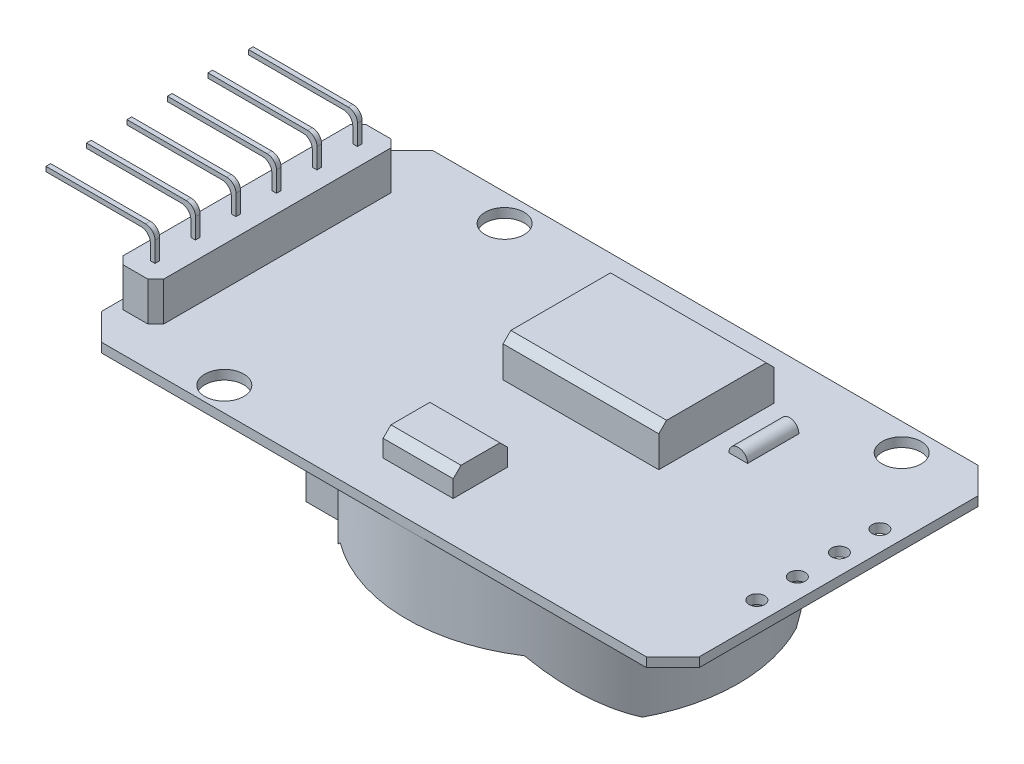
from build123d import *

# Parameters (mm, degrees)
SKETCH1_W             = 38.4
SKETCH1_H             = 21.3
SKETCH1_R             = 1.25
SKETCH1_R_2           = 0.5
BOSS_EXTRUDE1_DEPTH   = 0.6
CHAMFER1_SIZE         = 1.7
SKETCH3_W             = 2.6
SKETCH3_H             = 2.6
BOSS_EXTRUDE2_DEPTH   = 2.5
BOSS_EXTRUDE3_START   = -1.1
BOSS_EXTRUDE3_DEPTH   = 0.3
LPATTERN4_START       = -6.25
LPATTERN4_DEPTH       = 0.3
LPATTERN4_START_2     = -3.65
LPATTERN4_2_DEPTH     = 0.3
LPATTERN4_START_3     = -1.05
LPATTERN4_3_DEPTH     = 0.3
LPATTERN4_START_4     = 1.55
LPATTERN4_4_DEPTH     = 0.3
LPATTERN4_START_5     = 4.15
LPATTERN4_5_DEPTH     = 0.3
LPATTERN4_START_6     = -19.1
LPATTERN4_6_OUTLINE_W = 2.5
LPATTERN4_6_OUTLINE_H = 13
LPATTERN4_6_DEPTH     = 2.6
CHAMFER3_SIZE         = 0.5
SKETCH5_W             = 10
SKETCH5_H             = 7.4
BOSS_EXTRUDE4_DEPTH   = 2.5
SKETCH6_W             = 4.5
SKETCH6_H             = 3.5
BOSS_EXTRUDE5_DEPTH   = 1.6
CHAMFER4_SIZE         = 0.5
BOSS_EXTRUDE6_START   = -14
BOSS_EXTRUDE6_DEPTH   = 3.3
BOSS_EXTRUDE7_DEPTH   = 8.6
CUT_EXTRUDE1_DEPTH    = 34.693805069
SKETCH13_R            = 9.65
BOSS_EXTRUDE9_DEPTH   = 5


# Read off the part's stored shape, not the designer's step: LPattern4
with BuildPart() as part:
    # Sketch1 → Boss-Extrude1 (new body)
    with BuildSketch(Plane(origin=(0, 0, 0), x_dir=(1, 0, 0), z_dir=(0, 1, 0))):
        Rectangle(SKETCH1_W, SKETCH1_H)
        with Locations(Location((-11.15, 8.9, 0), (0, 0, 270))):
            Circle(SKETCH1_R, mode=Mode.SUBTRACT)
        with Locations(Location((14.35, 8.9, 0), (0, 0, 270))):
            Circle(SKETCH1_R, mode=Mode.SUBTRACT)
        with Locations(Location((-11.15, -9.1, 0), (0, 0, 270))):
            Circle(SKETCH1_R, mode=Mode.SUBTRACT)
        with Locations(Location((17.9, 3.95, 0), (0, 0, 270))):
            Circle(SKETCH1_R_2, mode=Mode.SUBTRACT)
        with Locations(Location((17.9, 1.35, 0), (0, 0, 270))):
            Circle(SKETCH1_R_2, mode=Mode.SUBTRACT)
        with Locations(Location((17.9, -1.35, 0), (0, 0, 270))):
            Circle(SKETCH1_R_2, mode=Mode.SUBTRACT)
        with Locations(Location((17.9, -3.95, 0), (0, 0, 270))):
            Circle(SKETCH1_R_2, mode=Mode.SUBTRACT)
    extrude(amount=BOSS_EXTRUDE1_DEPTH)

    # Chamfer1
    chamfer1_edges = [part.edges().sort_by_distance(p)[0] for p in [
        (-19.2, 0.3, -10.65),
        (19.2, 0.3, -10.65),
        (19.2, 0.3, 10.65),
        (-19.2, 0.3, 10.65),
    ]]
    chamfer(chamfer1_edges, length=CHAMFER1_SIZE)

    # Sketch3 → Boss-Extrude2 (add)
    with BuildSketch(Plane(origin=(0, 0.6, 0), x_dir=(1, 0, 0), z_dir=(0, 1, 0))):
        with Locations((-17.8, -6.85)):
            Rectangle(SKETCH3_W, SKETCH3_H)
    extrude(amount=BOSS_EXTRUDE2_DEPTH)

    # LPattern4 6 outline → LPattern4 6 (add)
    with BuildSketch(Plane.YZ.offset(LPATTERN4_START_6)):
        with Locations((1.85, -0.95)):
            Rectangle(LPATTERN4_6_OUTLINE_W, LPATTERN4_6_OUTLINE_H)
    extrude(amount=LPATTERN4_6_DEPTH)

    # Chamfer3
    chamfer3_edges = [part.edges().sort_by_distance(p)[0] for p in [
        (-19.1, 1.85, 8.15),
        (-16.5, 1.85, 8.15),
        (-19.1, 1.85, -7.45),
        (-16.5, 1.85, -7.45),
    ]]
    chamfer(chamfer3_edges, length=CHAMFER3_SIZE)

    # Sketch5 → Boss-Extrude4 (add)
    with BuildSketch(Plane(origin=(0, 0.6, 0), x_dir=(1, 0, 0), z_dir=(0, 1, 0))):
        with Locations((2.5, 3.85)):
            Rectangle(SKETCH5_W, SKETCH5_H)
    extrude(amount=BOSS_EXTRUDE4_DEPTH)

    # Sketch6 → Boss-Extrude5 (add)
    with BuildSketch(Plane(origin=(0, 0.6, 0), x_dir=(1, 0, 0), z_dir=(0, 1, 0))):
        with Locations((0.25, -6.3)):
            Rectangle(SKETCH6_W, SKETCH6_H)
    extrude(amount=BOSS_EXTRUDE5_DEPTH)

    # Chamfer4
    chamfer4_edges = [part.edges().sort_by_distance(p)[0] for p in [
        (2.5, 3.1, -0.15),
        (2.5, 3.1, -7.55),
        (0.25, 2.2, 8.05),
        (0.25, 2.2, 4.55),
    ]]
    chamfer(chamfer4_edges, length=CHAMFER4_SIZE)

    # Sketch8 → Boss-Extrude6 (add)
    with BuildSketch(Plane.XY.offset(10.65).offset(BOSS_EXTRUDE6_START)):
        with BuildLine():
            Line((8.8, 0.6), (10, 0.6))
            ThreePointArc((10, 0.6), (9.4, 1.2), (8.8, 0.6))
        make_face()
    extrude(amount=-BOSS_EXTRUDE6_DEPTH)

    # Sketch9 → Boss-Extrude7 (add)
    with BuildSketch(Plane.XZ):
        with BuildLine():
            Line((-7.867948636, -3.75), (-11.267948636, -3.75))
            Line((-11.267948636, -3.75), (-11.267948636, 3.75))
            Line((-11.267948636, 3.75), (-7.867948636, 3.75))
            ThreePointArc((-7.867948636, 3.75), (12.75, 0), (-7.867948636, -3.75))
        make_face()
        with BuildLine():
            Line((-10.767948636, 3.25), (-7.515612305, 3.25))
            ThreePointArc((-7.515612305, 3.25), (12.25, 0), (-7.515612305, -3.25))
            Line((-7.515612305, -3.25), (-10.767948636, -3.25))
            Line((-10.767948636, -3.25), (-10.767948636, 3.25))
        make_face(mode=Mode.SUBTRACT)
    extrude(amount=BOSS_EXTRUDE7_DEPTH)

    # Sketch10 → Cut-Extrude1 (cut, through all)
    with BuildSketch(Plane(origin=(0, 0, -10.65), x_dir=(-1, 0, 0), z_dir=(0, 0, -1))):
        Polygon((-11.532051364, -8.6), (-7.932051364, -5), (4.267948636, -5), (7.867948636, -8.6), align=None)
    extrude(amount=-CUT_EXTRUDE1_DEPTH, mode=Mode.SUBTRACT)

    # Sketch13 → Boss-Extrude9 (add)
    with BuildSketch(Plane.XZ):
        with Locations(Location((2.1, 0, 0), (0, 0, 90))):
            Circle(SKETCH13_R)
    extrude(amount=BOSS_EXTRUDE9_DEPTH)


with BuildPart() as body_2:
    # Sketch4 → Boss-Extrude3 (new body)
    with BuildSketch(Plane.XY.offset(8.15).offset(BOSS_EXTRUDE3_START)):
        with BuildLine():
            Line((-17.65, 3.1), (-17.95, 3.1))
            Line((-17.95, 3.1), (-17.95, 4.1))
            ThreePointArc((-17.95, 4.1), (-18.125735931, 4.524264069), (-18.55, 4.7))
            Line((-18.55, 4.7), (-24.65, 4.7))
            Line((-24.65, 4.7), (-24.65, 5))
            Line((-24.65, 5), (-18.25, 5))
            ThreePointArc((-18.25, 5), (-17.825735931, 4.824264069), (-17.65, 4.4))
            Line((-17.65, 4.4), (-17.65, 3.1))
        make_face()
    extrude(amount=-BOSS_EXTRUDE3_DEPTH)


with BuildPart() as body_3:
    # LPattern4 outline → LPattern4 (new body)
    with BuildSketch(Plane.XY.offset(LPATTERN4_START)):
        with BuildLine():
            Line((-17.95, 3.1), (-17.65, 3.1))
            Line((-17.65, 3.1), (-17.65, 4.4))
            ThreePointArc((-17.65, 4.4), (-17.825735931, 4.824264069), (-18.25, 5))
            Line((-18.25, 5), (-24.65, 5))
            Line((-24.65, 5), (-24.65, 4.7))
            Line((-24.65, 4.7), (-18.55, 4.7))
            ThreePointArc((-18.55, 4.7), (-18.125735931, 4.524264069), (-17.95, 4.1))
            Line((-17.95, 4.1), (-17.95, 3.1))
        make_face()
    extrude(amount=LPATTERN4_DEPTH)


with BuildPart() as body_4:
    # LPattern4 2 outline → LPattern4 2 (new body)
    with BuildSketch(Plane.XY.offset(LPATTERN4_START_2)):
        with BuildLine():
            Line((-17.95, 3.1), (-17.65, 3.1))
            Line((-17.65, 3.1), (-17.65, 4.4))
            ThreePointArc((-17.65, 4.4), (-17.825735931, 4.824264069), (-18.25, 5))
            Line((-18.25, 5), (-24.65, 5))
            Line((-24.65, 5), (-24.65, 4.7))
            Line((-24.65, 4.7), (-18.55, 4.7))
            ThreePointArc((-18.55, 4.7), (-18.125735931, 4.524264069), (-17.95, 4.1))
            Line((-17.95, 4.1), (-17.95, 3.1))
        make_face()
    extrude(amount=LPATTERN4_2_DEPTH)


with BuildPart() as body_5:
    # LPattern4 3 outline → LPattern4 3 (new body)
    with BuildSketch(Plane.XY.offset(LPATTERN4_START_3)):
        with BuildLine():
            Line((-17.95, 3.1), (-17.65, 3.1))
            Line((-17.65, 3.1), (-17.65, 4.4))
            ThreePointArc((-17.65, 4.4), (-17.825735931, 4.824264069), (-18.25, 5))
            Line((-18.25, 5), (-24.65, 5))
            Line((-24.65, 5), (-24.65, 4.7))
            Line((-24.65, 4.7), (-18.55, 4.7))
            ThreePointArc((-18.55, 4.7), (-18.125735931, 4.524264069), (-17.95, 4.1))
            Line((-17.95, 4.1), (-17.95, 3.1))
        make_face()
    extrude(amount=LPATTERN4_3_DEPTH)


with BuildPart() as body_6:
    # LPattern4 4 outline → LPattern4 4 (new body)
    with BuildSketch(Plane.XY.offset(LPATTERN4_START_4)):
        with BuildLine():
            Line((-17.95, 3.1), (-17.65, 3.1))
            Line((-17.65, 3.1), (-17.65, 4.4))
            ThreePointArc((-17.65, 4.4), (-17.825735931, 4.824264069), (-18.25, 5))
            Line((-18.25, 5), (-24.65, 5))
            Line((-24.65, 5), (-24.65, 4.7))
            Line((-24.65, 4.7), (-18.55, 4.7))
            ThreePointArc((-18.55, 4.7), (-18.125735931, 4.524264069), (-17.95, 4.1))
            Line((-17.95, 4.1), (-17.95, 3.1))
        make_face()
    extrude(amount=LPATTERN4_4_DEPTH)


with BuildPart() as body_7:
    # LPattern4 5 outline → LPattern4 5 (new body)
    with BuildSketch(Plane.XY.offset(LPATTERN4_START_5)):
        with BuildLine():
            Line((-17.95, 3.1), (-17.65, 3.1))
            Line((-17.65, 3.1), (-17.65, 4.4))
            ThreePointArc((-17.65, 4.4), (-17.825735931, 4.824264069), (-18.25, 5))
            Line((-18.25, 5), (-24.65, 5))
            Line((-24.65, 5), (-24.65, 4.7))
            Line((-24.65, 4.7), (-18.55, 4.7))
            ThreePointArc((-18.55, 4.7), (-18.125735931, 4.524264069), (-17.95, 4.1))
            Line((-17.95, 4.1), (-17.95, 3.1))
        make_face()
    extrude(amount=LPATTERN4_5_DEPTH)


solid = Compound([part.part, body_2.part, body_3.part, body_4.part, body_5.part, body_6.part, body_7.part])
